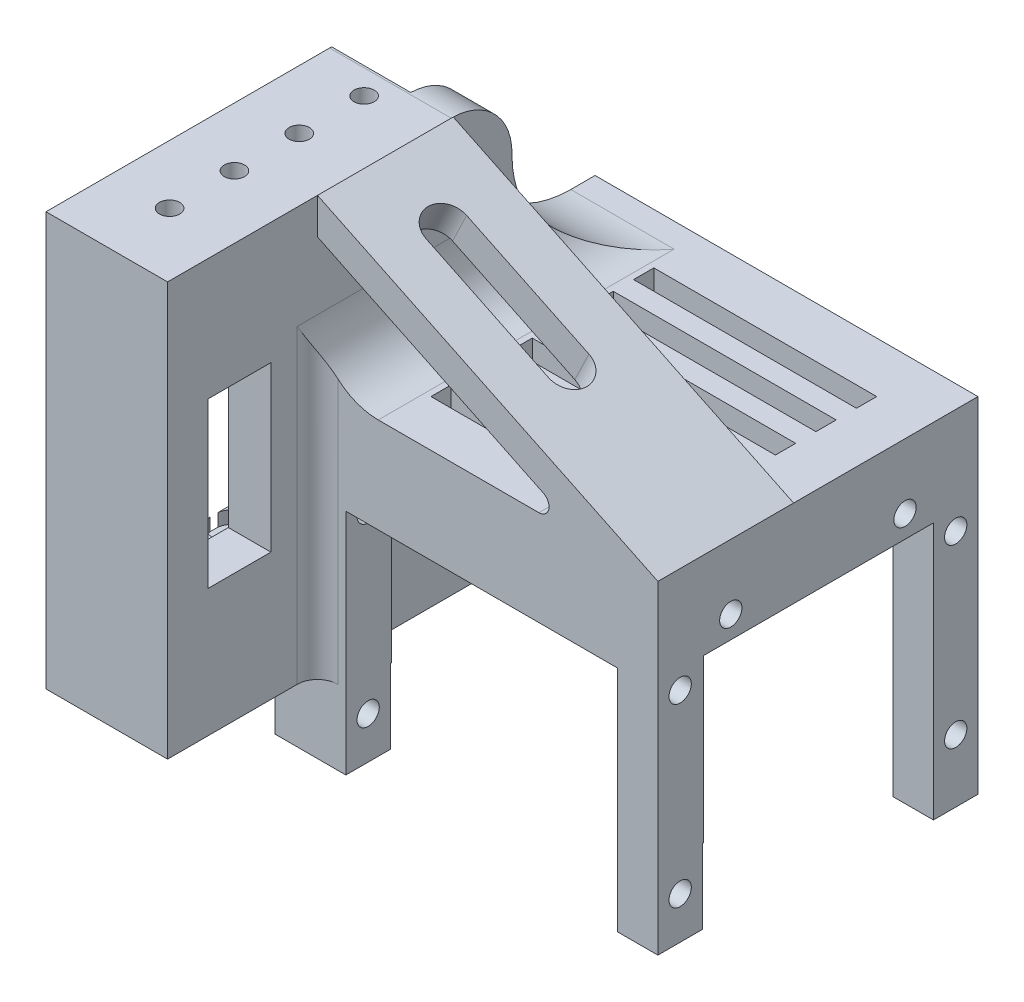
from build123d import *

# Parameters (mm, degrees)
SKETCH1_W               = 57.912
SKETCH1_H               = 63.754
BOSS_EXTRUDE1_DEPTH     = 58.928
SKETCH3_W               = 34.036
SKETCH3_H               = 31.242
SKETCH3_W_2             = 9.906
SKETCH3_H_2             = 11.938
CUT_EXTRUDE1_DEPTH      = 105.359385989
SKETCH4_R               = 1.27
SKETCH4_W               = 42.672
SKETCH4_H               = 18.796
SKETCH4_W_2             = 9.906
SKETCH4_H_2             = 23.114
CUT_EXTRUDE2_DEPTH      = 105.359385989
FILLET1_R               = 2.54
CUT_EXTRUDE3_DEPTH      = 20.574
FILLET2_R               = 12.7
FILLET3_R               = 7.62
FILLET4_R               = 7.62
CUT_EXTRUDE4_DEPTH      = 4.064
SKETCH8_W               = 27.94
SKETCH8_H               = 2.54
SKETCH8_W_2             = 13.716
CUT_EXTRUDE5_DEPTH      = 94.224574746
SKETCH9_W               = 34.036
SKETCH9_H               = 39.116
CUT_EXTRUDE6_DEPTH      = 5.588
BOSS_EXTRUDE3_DEPTH     = 34.036
FILLET5_R               = 3.048
CUT_EXTRUDE7_DEPTH      = 97.736659463
CUT_EXTRUDE7_DEPTH_BACK = 97.736659463
SKETCH12_W              = 7.874
SKETCH12_H              = 20.574
CUT_EXTRUDE8_START      = -42.672
SKETCH14_W              = 28.811262335
SKETCH14_H              = 20.32
CUT_EXTRUDE8_DEPTH      = 42.672
SKETCH17_R              = 1.397
CUT_EXTRUDE9_DEPTH      = 105.359385989
CUT_EXTRUDE10_DEPTH     = 30.734
SKETCH19_R              = 2.5908
CUT_EXTRUDE13_DEPTH     = 1.5875
CUT_EXTRUDE14_START     = -1.5875
SKETCH20_R              = 2.5908
CUT_EXTRUDE14_DEPTH     = 1.5875
SKETCH21_W              = 120.52010128
SKETCH21_H              = 73.641107421
CUT_EXTRUDE15_DEPTH     = 105.359385989
SKETCH22_W              = 86.597796927
SKETCH22_H              = 105.46219369
CUT_EXTRUDE16_DEPTH     = 145.749026511
SKETCH23_W              = 162.132243484
SKETCH23_H              = 110.038765939
CUT_EXTRUDE17_DEPTH     = 145.749026511


with BuildPart() as part:
    # Sketch1 → Boss-Extrude1 (new body)
    with BuildSketch(Plane.XY):
        with Locations((28.956, 31.877)):
            Rectangle(SKETCH1_W, SKETCH1_H)
    extrude(amount=-BOSS_EXTRUDE1_DEPTH)

    # Sketch3 → Cut-Extrude1 (cut, through all)
    with BuildSketch(Plane.XY):
        Polygon((42.672, 63.754), (0, 43.18), (0, 63.754), align=None)
        with BuildLine():
            Line((42.672, 59.242297846), (14.364369972, 45.593976225))
            ThreePointArc((14.364369972, 45.593976225), (13.677836685, 44.167112926), (14.915929938, 43.18))
            Line((14.915929938, 43.18), (42.672, 43.18))
            Line((42.672, 43.18), (42.672, 59.242297846))
        make_face()
        with Locations((22.098, 15.621)):
            Rectangle(SKETCH3_W, SKETCH3_H)
        with Locations((52.959, 5.969)):
            Rectangle(SKETCH3_W_2, SKETCH3_H_2)
    extrude(amount=-CUT_EXTRUDE1_DEPTH, mode=Mode.SUBTRACT)

    # Sketch4 → Cut-Extrude2 (cut, through all)
    with BuildSketch(Plane(origin=(0, 63.754, 0), x_dir=(1, 0, 0), z_dir=(0, 1, 0))):
        with Locations(Location((50.546, 32.512, 0), (0, 0, 270))):
            Circle(SKETCH4_R)
        with Locations(Location((50.546, 24.384, 0), (0, 0, 270))):
            Circle(SKETCH4_R)
        with Locations(Location((50.546, 16.256, 0), (0, 0, 270))):
            Circle(SKETCH4_R)
        with Locations(Location((50.546, 8.128, 0), (0, 0, 270))):
            Circle(SKETCH4_R)
        with Locations((21.336, 9.398)):
            Rectangle(SKETCH4_W, SKETCH4_H)
        with Locations((52.959, 47.371)):
            Rectangle(SKETCH4_W_2, SKETCH4_H_2)
    extrude(amount=-CUT_EXTRUDE2_DEPTH, mode=Mode.SUBTRACT)

    # Fillet1
    fillet1_edges = [part.edges().sort_by_distance(p)[0] for p in [
        (42.672, 21.59, -18.796),
    ]]
    fillet(fillet1_edges, radius=FILLET1_R)

    # Sketch6 → Cut-Extrude3 (cut)
    with BuildSketch(Plane(origin=(0, 63.754, 0), x_dir=(1, 0, 0), z_dir=(0, 1, 0))):
        Polygon((42.672, 35.814), (0, 35.814), (0, 58.928), (48.006, 58.928), (48.006, 43.18), (42.672, 43.18), align=None)
    extrude(amount=-CUT_EXTRUDE3_DEPTH, mode=Mode.SUBTRACT)

    # Fillet2
    fillet2_edges = [part.edges().sort_by_distance(p)[0] for p in [
        (45.339, 43.18, -43.18),
    ]]
    fillet(fillet2_edges, radius=FILLET2_R)

    # Fillet3
    fillet3_edges = [part.edges().sort_by_distance(p)[0] for p in [
        (42.672, 43.18, -36.068),
    ]]
    fillet(fillet3_edges, radius=FILLET3_R)

    # Fillet4
    # the kernel refuses this fillet: 7.62 mm, written as the material it takes off along each edge
    with BuildSketch(Plane(origin=(67.056, 63.754, -43.18), x_dir=(0, 0, 1), z_dir=(-1, 0, 0))) as fillet4_piece_1:
        with BuildLine():
            CenterArc((FILLET4_R, -FILLET4_R), FILLET4_R, 90, 90)
            Line((0, -FILLET4_R), (0, 0))
            Line((0, 0), (FILLET4_R, 0))
        make_face()
    extrude(amount=43.434, mode=Mode.SUBTRACT)

    # Sketch7 → Cut-Extrude4 (cut)
    with BuildSketch(Plane(origin=(-16.892150065, 35.035570505, 0), x_dir=(0.9007686813688952, 0.43429918566000303, 0), z_dir=(-0.43429918566000303, 0.9007686813688952, 0))):
        with BuildLine():
            Line((57.489911454, 24.638), (40.471911454, 24.638))
            ThreePointArc((40.471911454, 24.638), (37.931911454, 27.178), (40.471911454, 29.718))
            Line((40.471911454, 29.718), (57.489911454, 29.718))
            ThreePointArc((57.489911454, 29.718), (60.029911454, 27.178), (57.489911454, 24.638))
        make_face()
    extrude(amount=-CUT_EXTRUDE4_DEPTH, mode=Mode.SUBTRACT)

    # Sketch8 → Cut-Extrude5 (cut, through all)
    with BuildSketch(Plane(origin=(0, 43.18, 0), x_dir=(1, 0, 0), z_dir=(0, 1, 0))):
        with Locations((20.32, 51.308)):
            Rectangle(SKETCH8_W, SKETCH8_H)
        with Locations((20.32, 46.228)):
            Rectangle(SKETCH8_W, SKETCH8_H)
        with Locations((20.32, 41.148)):
            Rectangle(SKETCH8_W, SKETCH8_H)
        with Locations((27.432, 36.068)):
            Rectangle(SKETCH8_W_2, SKETCH8_H)
        with Locations((27.432, 30.988)):
            Rectangle(SKETCH8_W_2, SKETCH8_H)
        with Locations((27.432, 25.908)):
            Rectangle(SKETCH8_W_2, SKETCH8_H)
    extrude(amount=-CUT_EXTRUDE5_DEPTH, mode=Mode.SUBTRACT)

    # Sketch9 → Cut-Extrude6 (cut)
    with BuildSketch(Plane.XZ.offset(-31.242)):
        with Locations((22.098, -38.862)):
            Rectangle(SKETCH9_W, SKETCH9_H)
    extrude(amount=-CUT_EXTRUDE6_DEPTH, mode=Mode.SUBTRACT)

    # Sketch10 → Boss-Extrude3 (add)
    with BuildSketch(Plane(origin=(5.08, 0, 0), x_dir=(0, 0, -1), z_dir=(1, 0, 0))):
        Polygon((58.42, 31.242), (54.619546979, 36.83), (58.42, 36.83), align=None)
    boss_extrude3 = extrude(amount=BOSS_EXTRUDE3_DEPTH)

    # Mirror1: Boss-Extrude3 across plane
    add(boss_extrude3.mirror(Plane.XY.offset(-38.862)))

    # Fillet5
    # the kernel refuses this fillet: 3.048 mm, written as the material it adds along each edge
    with BuildSketch(Plane(origin=(1.047120303, 36.83, -54.619546979), x_dir=(0, -0.8268843197776327, -0.5623720491861963), z_dir=(1, 0, 0))) as fillet5_piece_1:
        with BuildLine():
            CenterArc((FILLET5_R * 0.5292493041, -FILLET5_R), FILLET5_R, 90, 55.78)
            Line((-FILLET5_R * 0.297635015677, -FILLET5_R * 0.437627950814), (0, 0))
            Line((0, 0), (FILLET5_R * 0.5292493041, 0))
        make_face()
    extrude(amount=42.101759394)
    with BuildSketch(Plane(origin=(1.047120303, 36.83, -23.104453021), x_dir=(0, 0, -1), z_dir=(1, 0, 0))) as fillet5_piece_2_section:
        with BuildLine():
            CenterArc((FILLET5_R * 0.5292493041, -FILLET5_R), FILLET5_R, 90, 55.78)
            Line((-FILLET5_R * 0.297635015677, -FILLET5_R * 0.437627950814), (0, 0))
            Line((0, 0), (FILLET5_R * 0.5292493041, 0))
        make_face()
    fillet5_piece_2 = extrude(amount=42.101759394, mode=Mode.PRIVATE)
    fillet5_piece_2 = split(fillet5_piece_2, bisect_by=Plane(origin=(20.574, 36.829688099, -24.657900546), z_dir=(-1, 0, 0)), keep=Keep.TOP, mode=Mode.PRIVATE)
    add(fillet5_piece_2)
    with BuildSketch(Plane(origin=(1.047120303, 36.83, -23.104453021), x_dir=(0, 0, -1), z_dir=(1, 0, 0))) as fillet5_piece_3_section:
        with BuildLine():
            CenterArc((FILLET5_R * 0.5292493041, -FILLET5_R), FILLET5_R, 90, 55.78)
            Line((-FILLET5_R * 0.297635015677, -FILLET5_R * 0.437627950814), (0, 0))
            Line((0, 0), (FILLET5_R * 0.5292493041, 0))
        make_face()
    fillet5_piece_3 = extrude(amount=42.101759394, mode=Mode.PRIVATE)
    fillet5_piece_3 = split(fillet5_piece_3, bisect_by=Plane(origin=(27.432, 36.551953176, -24.638), z_dir=(0, 0, 1)), keep=Keep.TOP, mode=Mode.PRIVATE)
    add(fillet5_piece_3)
    with BuildSketch(Plane(origin=(1.047120303, 36.83, -23.104453021), x_dir=(0, 0, -1), z_dir=(1, 0, 0))) as fillet5_piece_4_section:
        with BuildLine():
            CenterArc((FILLET5_R * 0.5292493041, -FILLET5_R), FILLET5_R, 90, 55.78)
            Line((-FILLET5_R * 0.297635015677, -FILLET5_R * 0.437627950814), (0, 0))
            Line((0, 0), (FILLET5_R * 0.5292493041, 0))
        make_face()
    fillet5_piece_4 = extrude(amount=42.101759394, mode=Mode.PRIVATE)
    fillet5_piece_4 = split(fillet5_piece_4, bisect_by=Plane(origin=(34.29, 36.829688099, -24.657900546), z_dir=(1, 0, 0)), keep=Keep.TOP, mode=Mode.PRIVATE)
    add(fillet5_piece_4)

    # Sketch12 → Cut-Extrude7 (cut, two sides: drawn at the far end of the back side and taken through both)
    with BuildSketch(Plane.ZY.offset(-42.672).offset(-CUT_EXTRUDE7_DEPTH_BACK)):
        with Locations((-9.017, 38.227)):
            Rectangle(SKETCH12_W, SKETCH12_H)
        Polygon((-53.34, 0), (-53.34, 11.938), (-24.384, 11.938), (-24.384, 2.597585734), (-18.796, 2.597585734), (-18.796, 11.938), (0, 11.938), (0, 0), align=None)
    extrude(amount=CUT_EXTRUDE7_DEPTH + CUT_EXTRUDE7_DEPTH_BACK, mode=Mode.SUBTRACT)

    # Sketch14 → Cut-Extrude8 (cut)
    with BuildSketch(Plane.ZY.offset(CUT_EXTRUDE8_START)):
        with Locations((-38.934368832, 22.098)):
            Rectangle(SKETCH14_W, SKETCH14_H)
    extrude(amount=CUT_EXTRUDE8_DEPTH, mode=Mode.SUBTRACT)

    # Sketch17 → Cut-Extrude9 (cut, through all)
    with BuildSketch(Plane.ZY):
        with Locations((-56.134, 7.874)):
            Circle(SKETCH17_R)
        with Locations((-56.134, 29.972)):
            Circle(SKETCH17_R)
        with Locations((-49.784, 35.052)):
            Circle(SKETCH17_R)
        with Locations(Location((-21.59, 7.874, 0), (0, 0, 270))):
            Circle(SKETCH17_R)
        with Locations(Location((-21.59, 29.972, 0), (0, 0, 90))):
            Circle(SKETCH17_R)
        with Locations(Location((-27.94, 35.052, 0), (0, 0, 90))):
            Circle(SKETCH17_R)
    extrude(amount=-CUT_EXTRUDE9_DEPTH, mode=Mode.SUBTRACT)

    # Sketch18 → Cut-Extrude10 (cut)
    with BuildSketch(Plane(origin=(0, 0, -35.814), x_dir=(-1, 0, 0), z_dir=(0, 0, -1))):
        Polygon((-57.912, 58.66976549), (-48.006, 58.66976549), (-48.006, 53.84376549), (-53.086, 53.84376549), (-53.086, 50.54176549), (-48.006, 50.54176549), (-48.006, 25.146), (-53.086, 25.146), (-53.086, 21.844), (-48.006, 21.844), (-48.006, 17.018), (-57.912, 17.018), align=None)
    extrude(amount=-CUT_EXTRUDE10_DEPTH, mode=Mode.SUBTRACT)

    # Sketch19 → Cut-Extrude13 (cut)
    with BuildSketch(Plane(origin=(0, 25.146, 0), x_dir=(1, 0, 0), z_dir=(0, 1, 0))):
        with Locations((50.546, 32.512)):
            Circle(SKETCH19_R)
        with Locations((50.546, 24.384)):
            Circle(SKETCH19_R)
        with Locations((50.546, 16.256)):
            Circle(SKETCH19_R)
        with Locations((50.546, 8.128)):
            Circle(SKETCH19_R)
    extrude(amount=-CUT_EXTRUDE13_DEPTH, mode=Mode.SUBTRACT)

    # Sketch20 → Cut-Extrude14 (cut)
    with BuildSketch(Plane.XZ.offset(-50.54176549).offset(CUT_EXTRUDE14_START)):
        with Locations((50.546, -8.128)):
            Circle(SKETCH20_R)
        with Locations((50.546, -16.256)):
            Circle(SKETCH20_R)
        with Locations((50.546, -24.384)):
            Circle(SKETCH20_R)
        with Locations((50.546, -32.512)):
            Circle(SKETCH20_R)
    extrude(amount=CUT_EXTRUDE14_DEPTH, mode=Mode.SUBTRACT)

    # Mirror2: part across plane


with BuildPart() as part_1:
    add(part.part)
    add(part.part.mirror(Plane.XY))

    # Sketch21 → Cut-Extrude15 (cut, through all)
    with BuildSketch(Plane(origin=(0, 63.754, 0), x_dir=(1, 0, 0), z_dir=(0, 1, 0))):
        with Locations((23.293572064, 36.820553711)):
            Rectangle(SKETCH21_W, SKETCH21_H)
    extrude(amount=-CUT_EXTRUDE15_DEPTH, mode=Mode.SUBTRACT)

    # Mirror3: part across plane


with BuildPart() as part_2:
    add(part_1.part)
    add(part_1.part.mirror(Plane(origin=(57.912, 0, -58.928), x_dir=(0, 0, 1), z_dir=(1, 0, 0))))

    # Sketch22 → Cut-Extrude16 (cut, through all)
    with BuildSketch(Plane(origin=(0, 63.754, 0), x_dir=(1, 0, 0), z_dir=(0, 1, 0))):
        with Locations((14.613101537, -29.722936648)):
            Rectangle(SKETCH22_W, SKETCH22_H)
    extrude(amount=-CUT_EXTRUDE16_DEPTH, mode=Mode.SUBTRACT)

    # Mirror4: part across plane


with BuildPart() as part_3:
    add(part_2.part)
    add(part_2.part.mirror(Plane(origin=(83.553622704, 0, 0), x_dir=(1, 0, 0), z_dir=(0, 0, 1))))

    # Sketch23 → Cut-Extrude17 (cut, through all)
    with BuildSketch(Plane(origin=(0, 63.754, 0), x_dir=(1, 0, 0), z_dir=(0, 1, 0))):
        with Locations((94.881956265, -55.01938297)):
            Rectangle(SKETCH23_W, SKETCH23_H)
    extrude(amount=-CUT_EXTRUDE17_DEPTH, mode=Mode.SUBTRACT)


solid = part_3.part
